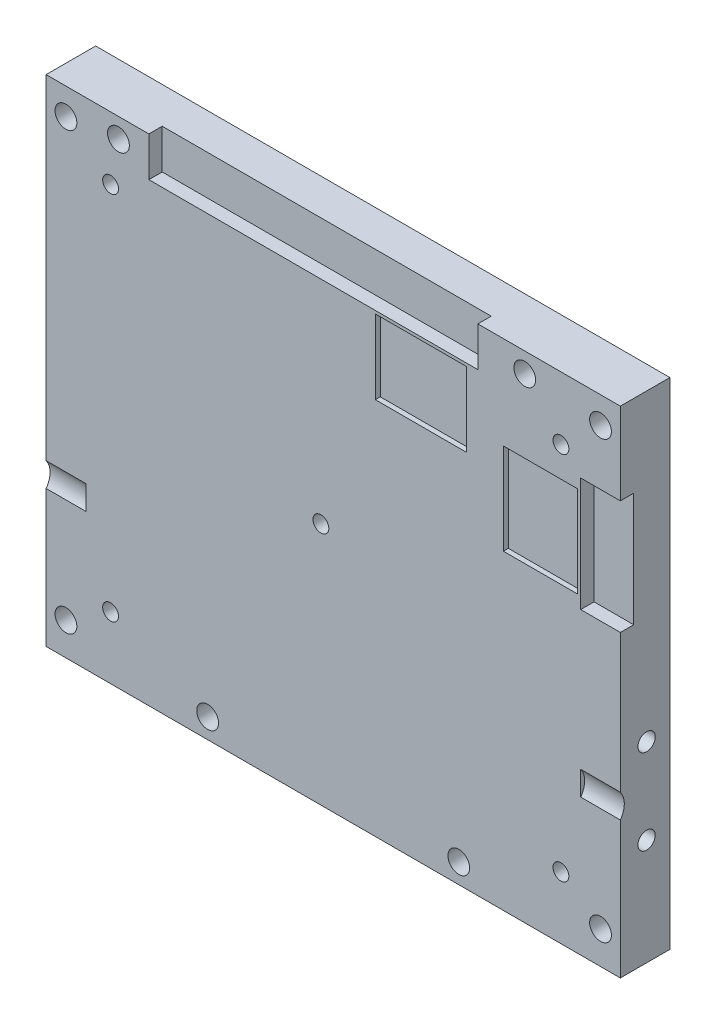
from build123d import *

# Parameters (mm, degrees)
SKETCH_1_W                     = 57.95
SKETCH_1_H                     = 49.98
FLAT_BASE_5MM_DEPTH            = 5
SKETCH_2_R                     = 1.1
FRAME_8XD2P2_THROUGH_DEPTH     = 71.63982517
SKETCH_3_R                     = 0.8
PCB_5XD1P6_M2_THROUGH_DEPTH    = 71.63982517
SKETCH_4_R                     = 2.05
SMA_CENTER_MATCHING_ARC_DEPTH  = 4
SKETCH_5_R                     = 0.875
SMA_LOWER_2XD1P75_BLIND4_DEPTH = 4
CUT_EXTRUDE_START              = -4
SKETCH_6_R                     = 2.05
CUT_EXTRUDE_5_DEPTH            = 4
SKETCH_7_R                     = 0.875
CUT_EXTRUDE_6_DEPTH            = 4
SKETCH_8_W                     = 6.7
SKETCH_8_H                     = 11.5
RIGHT_TYPEC_WINDOW_LOWER_DEPTH = 4
SKETCH_9_W                     = 33.203
SKETCH_9_H                     = 6.7
REAR_WINDOW_LOWER_DEPTH        = 4
SKETCH_10_W                    = 7.5
SKETCH_10_H                    = 9.2
TYPEC_BOTTOM_RECESS_A_DEPTH    = 0.5
SKETCH_11_W                    = 9.2
SKETCH_11_H                    = 7.5
TYPEC_BOTTOM_RECESS_B_DEPTH    = 0.5


with BuildPart() as part:
    # 草图1 → Flat_Base_5mm (new body)
    with BuildSketch(Plane.XY):
        with Locations((24.675, 20.69)):
            Rectangle(SKETCH_1_W, SKETCH_1_H)
    extrude(amount=FLAT_BASE_5MM_DEPTH)


with BuildPart() as part_1:
    # Stock_Z_Position: moved
    add(part.part.moved(Location((0, 0, -2.751909566))))

    # 草图2 → Frame_8xD2p2_Through (cut, through all)
    with BuildSketch(Plane.XY.offset(2.248090434)):
        with Locations((-2.3, -1)):
            Circle(SKETCH_2_R)
        with Locations((-2.3, 43)):
            Circle(SKETCH_2_R)
        with Locations((51.65, -1)):
            Circle(SKETCH_2_R)
        with Locations((51.65, 43)):
            Circle(SKETCH_2_R)
        with Locations((12, -2.3)):
            Circle(SKETCH_2_R)
        with Locations((37.35, -2.3)):
            Circle(SKETCH_2_R)
        with Locations((3, 43.68)):
            Circle(SKETCH_2_R)
        with Locations((44, 43.68)):
            Circle(SKETCH_2_R)
    extrude(amount=-FRAME_8XD2P2_THROUGH_DEPTH, mode=Mode.SUBTRACT)

    # 草图3 → PCB_5xD1p6_M2_Through (cut, through all)
    with BuildSketch(Plane.XY.offset(2.248090434)):
        with Locations((23.428293927, 20.276755792)):
            Circle(SKETCH_3_R)
        with Locations((2.206251763, 39.333791606)):
            Circle(SKETCH_3_R)
        with Locations((47.653340917, 39.333791606)):
            Circle(SKETCH_3_R)
        with Locations((47.653340917, 1.976720232)):
            Circle(SKETCH_3_R)
        with Locations((2.206251763, 1.976720232)):
            Circle(SKETCH_3_R)
    extrude(amount=-PCB_5XD1P6_M2_THROUGH_DEPTH, mode=Mode.SUBTRACT)

    # 草图4 → SMA_Center_Matching_Arc (cut)
    with BuildSketch(Plane.ZY.offset(4.3)):
        with Locations((3.899496327, 10.725)):
            Circle(SKETCH_4_R)
    extrude(amount=-SMA_CENTER_MATCHING_ARC_DEPTH, mode=Mode.SUBTRACT)

    # 草图5 → SMA_Lower_2xD1p75_Blind4 (cut)
    with BuildSketch(Plane.ZY.offset(4.3)):
        with Locations((-0.400503673, 6.425)):
            Circle(SKETCH_5_R)
        with Locations((-0.400503673, 15.025)):
            Circle(SKETCH_5_R)
    extrude(amount=-SMA_LOWER_2XD1P75_BLIND4_DEPTH, mode=Mode.SUBTRACT)

    # 草图6 → 切除-拉伸5 (cut)
    with BuildSketch(Plane(origin=(53.65, 0, 0), x_dir=(0, 0, -1), z_dir=(1, 0, 0)).offset(CUT_EXTRUDE_START)):
        with Locations((-3.899496327, 10.725)):
            Circle(SKETCH_6_R)
    extrude(amount=CUT_EXTRUDE_5_DEPTH, mode=Mode.SUBTRACT)

    # 草图7 → 切除-拉伸6 (cut)
    with BuildSketch(Plane(origin=(53.65, 0, 0), x_dir=(0, 0, -1), z_dir=(1, 0, 0)).offset(CUT_EXTRUDE_START)):
        with Locations((0.400503673, 6.425)):
            Circle(SKETCH_7_R)
        with Locations((0.400503673, 15.025)):
            Circle(SKETCH_7_R)
    extrude(amount=CUT_EXTRUDE_6_DEPTH, mode=Mode.SUBTRACT)

    # 草图8 → Right_TypeC_Window_Lower (cut)
    with BuildSketch(Plane(origin=(53.65, 0, 0), x_dir=(0, 0, -1), z_dir=(1, 0, 0))):
        with Locations((-4.25, 31.65)):
            Rectangle(SKETCH_8_W, SKETCH_8_H)
    extrude(amount=-RIGHT_TYPEC_WINDOW_LOWER_DEPTH, mode=Mode.SUBTRACT)

    # 草图9 → Rear_Window_Lower (cut)
    with BuildSketch(Plane(origin=(0, 45.68, 0), x_dir=(1, 0, 0), z_dir=(0, 1, 0))):
        with Locations((22.6715, -4.25)):
            Rectangle(SKETCH_9_W, SKETCH_9_H)
    extrude(amount=-REAR_WINDOW_LOWER_DEPTH, mode=Mode.SUBTRACT)

    # 草图10 → TypeC_Bottom_Recess_A (cut)
    with BuildSketch(Plane.XY.offset(2.248090434)):
        with Locations((45.6, 31.7)):
            Rectangle(SKETCH_10_W, SKETCH_10_H)
    extrude(amount=-TYPEC_BOTTOM_RECESS_A_DEPTH, mode=Mode.SUBTRACT)

    # 草图11 → TypeC_Bottom_Recess_B (cut)
    with BuildSketch(Plane.XY.offset(2.248090434)):
        with Locations((33.523, 37.63)):
            Rectangle(SKETCH_11_W, SKETCH_11_H)
    extrude(amount=-TYPEC_BOTTOM_RECESS_B_DEPTH, mode=Mode.SUBTRACT)


solid = part_1.part
